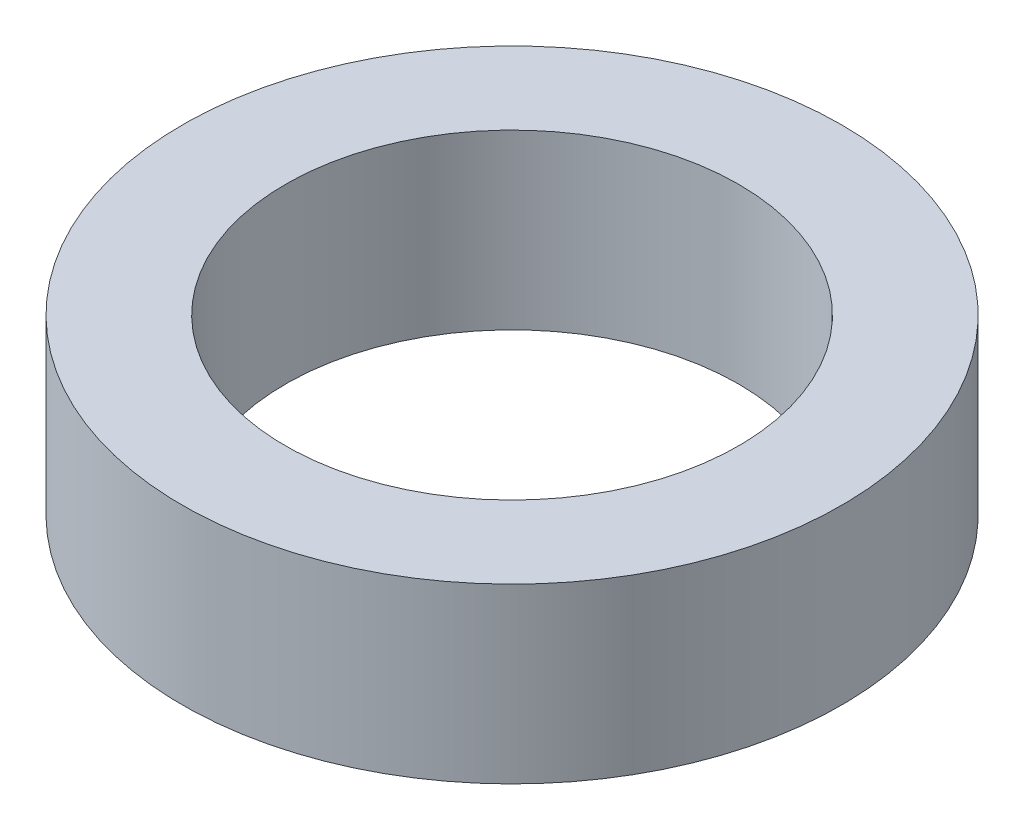
from build123d import *

# Parameters (mm, degrees)
SKETCH1_R           = 40
BOSS_EXTRUDE1_DEPTH = 21
SKETCH2_R           = 27.5
CUT_EXTRUDE1_DEPTH  = 61.340699366


with BuildPart() as part:
    # Sketch1 → Boss-Extrude1 (new body)
    with BuildSketch(Plane(origin=(0, 0, 0), x_dir=(1, 0, 0), z_dir=(0, 1, 0))):
        Circle(SKETCH1_R)
    extrude(amount=BOSS_EXTRUDE1_DEPTH)

    # Sketch2 → Cut-Extrude1 (cut, through all)
    with BuildSketch(Plane(origin=(0, 0, 0), x_dir=(1, 0, 0), z_dir=(0, 1, 0))):
        Circle(SKETCH2_R)
    extrude(amount=CUT_EXTRUDE1_DEPTH, mode=Mode.SUBTRACT)


solid = part.part
